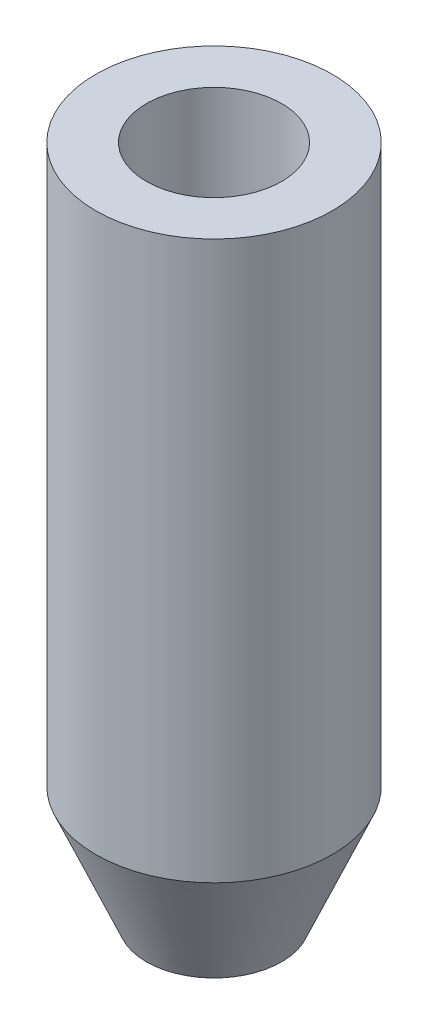
from build123d import *

# Parameters (mm, degrees)
SKETCH1_R               = 3.5
BOSS_EXTRUDE1_DEPTH     = 10
CHAMFER1_SIZE           = 1.5
CHAMFER1_SIZE2          = 3.5
CUT_EXTRUDE1_DEPTH      = 21.603397778
CUT_EXTRUDE1_DEPTH_BACK = 21.603397778
SKETCH2_R               = 0.875
SKETCH3_R               = 1.35
CUT_EXTRUDE2_DEPTH      = 3.5
SKETCH4_R               = 2
CUT_EXTRUDE3_DEPTH      = 5


with BuildPart() as part:
    # Sketch1 → Boss-Extrude1 (new, symmetric)
    with BuildSketch(Plane(origin=(0, 0, 0), x_dir=(1, 0, 0), z_dir=(0, 1, 0))):
        Circle(SKETCH1_R)
    extrude(amount=BOSS_EXTRUDE1_DEPTH, both=True)

    # Chamfer1
    chamfer1_edges = [part.edges().sort_by_distance(p)[0] for p in [
        (-3.5, -10, 0),
    ]]
    chamfer1_side = [part.faces().sort_by_distance(p)[0] for p in [
        (0, -10, 0),
    ]]
    chamfer(chamfer1_edges, length=CHAMFER1_SIZE, length2=CHAMFER1_SIZE2, reference=chamfer1_side[0])

    # Sketch2 → Cut-Extrude1 (cut, two sides: drawn at the far end of the back side and taken through both)
    with BuildSketch(Plane.XZ.offset(10).offset(-CUT_EXTRUDE1_DEPTH_BACK)):
        Circle(SKETCH2_R)
    extrude(amount=CUT_EXTRUDE1_DEPTH + CUT_EXTRUDE1_DEPTH_BACK, mode=Mode.SUBTRACT)

    # Sketch3 → Cut-Extrude2 (cut)
    with BuildSketch(Plane.XZ.offset(10)):
        Circle(SKETCH3_R)
    extrude(amount=-CUT_EXTRUDE2_DEPTH, mode=Mode.SUBTRACT)

    # Sketch4 → Cut-Extrude3 (cut)
    with BuildSketch(Plane(origin=(0, 10, 0), x_dir=(1, 0, 0), z_dir=(0, 1, 0))):
        Circle(SKETCH4_R)
    extrude(amount=-CUT_EXTRUDE3_DEPTH, mode=Mode.SUBTRACT)


solid = part.part
